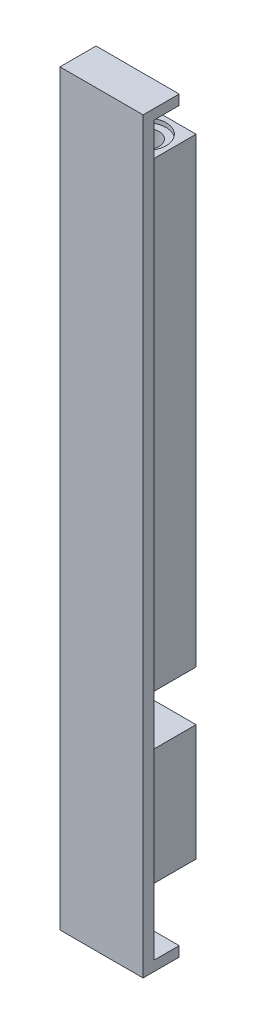
from build123d import *

# Parameters (mm, degrees)
BOSS_EXTRUDE2_DEPTH             = 75.5
BOSS_EXTRUDE3_DEPTH             = 85.5
SKETCH7_W                       = 37.5
SKETCH7_H                       = 6
SKETCH9_R                       = 1.55
CUT_EXTRUDE4_DEPTH              = 4.3
SKETCH10_R                      = 2.4
CUT_EXTRUDE5_DEPTH              = 0.5
SKETCH13_R                      = 2.4
CUT_EXTRUDE6_DEPTH              = 0.5
SKETCH14_R                      = 1.55
CUT_EXTRUDE7_DEPTH              = 4.3
SKIZZE1_W                       = 10
SKIZZE1_H                       = 1.341711746
AUFSATZ_LINEAR_AUSTRAGEN1_DEPTH = 2.2
SKIZZE2_W                       = 10
SKIZZE2_H                       = 1.2
AUFSATZ_LINEAR_AUSTRAGEN2_DEPTH = 3
SKIZZE3_W                       = 10
SKIZZE3_H                       = 1.341711746
AUFSATZ_LINEAR_AUSTRAGEN3_DEPTH = 2.2
SKIZZE4_W                       = 10
SKIZZE4_H                       = 1.2
AUFSATZ_LINEAR_AUSTRAGEN4_DEPTH = 3


with BuildPart() as part:
    # Sketch3 → Boss-Extrude2 (new body)
    with BuildSketch(Plane.XZ.offset(5)):
        with BuildLine():
            Line((-3, 37.379807383), (-3, 31.379807383))
            Line((-3, 31.379807383), (3, 31.379807383))
            Line((3, 31.379807383), (3, 37.379807383))
            ThreePointArc((3, 37.379807383), (0, 37.5), (-3, 37.379807383))
        make_face()
    extrude(amount=BOSS_EXTRUDE2_DEPTH)

    # Sketch5 → Boss-Extrude3 (add)
    with BuildSketch(Plane(origin=(0, 0, 0), x_dir=(1, 0, 0), z_dir=(0, 1, 0))):
        with BuildLine():
            Line((-5, -38.409398717), (-5, -39.236412732))
            Line((-5, -39.236412732), (-5, -39.751110463))
            Line((-5, -39.751110463), (0, -39.751110463))
            Line((0, -39.751110463), (5, -39.751110463))
            Line((5, -39.751110463), (5, -39.41427469))
            Line((5, -39.41427469), (5, -38.409398717))
            ThreePointArc((5, -38.409398717), (3.502649729, -38.574776145), (2.00000116, -38.681803282))
            Line((2.00000116, -38.681803282), (2.00000116, -37.431803282))
            ThreePointArc((2.00000116, -37.431803282), (0, -37.485195766), (-2.00000116, -37.431803282))
            Line((-2.00000116, -37.431803282), (-2.00000116, -38.681803282))
            ThreePointArc((-2.00000116, -38.681803282), (-3.502649729, -38.574776145), (-5, -38.409398717))
        make_face()
    extrude(amount=-BOSS_EXTRUDE3_DEPTH)

    # Sketch7 → Cut-Revolve1 (revolve, cut)
    with BuildSketch(Plane(origin=(0, 0, 0), x_dir=(0, 0, -1), z_dir=(1, 0, 0))):
        with Locations((-18.75, -63.5)):
            Rectangle(SKETCH7_W, SKETCH7_H)
    revolve(axis=Axis((0, -27.016689378, 0), (0, -1, 0)), mode=Mode.SUBTRACT)

    # Sketch9 → Cut-Extrude4 (cut)
    with BuildSketch(Plane(origin=(0, -80.5, 0), x_dir=(-1, 0, 0), z_dir=(0, -1, 0))):
        with Locations((0, -34.420864201)):
            Circle(SKETCH9_R)
    extrude(amount=-CUT_EXTRUDE4_DEPTH, mode=Mode.SUBTRACT)

    # Sketch10 → Cut-Extrude5 (cut)
    with BuildSketch(Plane(origin=(0, -80.5, 0), x_dir=(-1, 0, 0), z_dir=(0, -1, 0))):
        with Locations((0, -34.420864201)):
            Circle(SKETCH10_R)
    extrude(amount=-CUT_EXTRUDE5_DEPTH, mode=Mode.SUBTRACT)

    # Sketch13 → Cut-Extrude6 (cut)
    with BuildSketch(Plane(origin=(0, -5, 0), x_dir=(-1, 0, 0), z_dir=(0, -1, 0))):
        with Locations((0, -34.379807383)):
            Circle(SKETCH13_R)
    extrude(amount=CUT_EXTRUDE6_DEPTH, mode=Mode.SUBTRACT)

    # Sketch14 → Cut-Extrude7 (cut)
    with BuildSketch(Plane(origin=(0, -5, 0), x_dir=(-1, 0, 0), z_dir=(0, -1, 0))):
        with Locations((0, -34.379807383)):
            Circle(SKETCH14_R)
    extrude(amount=CUT_EXTRUDE7_DEPTH, mode=Mode.SUBTRACT)

    # Skizze1 → Aufsatz-Linear austragen1 (add)
    with BuildSketch(Plane(origin=(0, 0, 0), x_dir=(1, 0, 0), z_dir=(0, 1, 0))):
        with Locations((0, -39.08025459)):
            Rectangle(SKIZZE1_W, SKIZZE1_H)
    extrude(amount=AUFSATZ_LINEAR_AUSTRAGEN1_DEPTH)

    # Skizze2 → Aufsatz-Linear austragen2 (add)
    with BuildSketch(Plane(origin=(0, 0, 38.409398717), x_dir=(-1, 0, 0), z_dir=(0, 0, -1))):
        with Locations((0, 1.6)):
            Rectangle(SKIZZE2_W, SKIZZE2_H)
    extrude(amount=AUFSATZ_LINEAR_AUSTRAGEN2_DEPTH)

    # Skizze3 → Aufsatz-Linear austragen3 (add)
    with BuildSketch(Plane.XZ.offset(85.5)):
        with Locations((0, 39.08025459)):
            Rectangle(SKIZZE3_W, SKIZZE3_H)
    extrude(amount=AUFSATZ_LINEAR_AUSTRAGEN3_DEPTH)

    # Skizze4 → Aufsatz-Linear austragen4 (add)
    with BuildSketch(Plane(origin=(0, 0, 38.409398717), x_dir=(-1, 0, 0), z_dir=(0, 0, -1))):
        with Locations((0, -87.1)):
            Rectangle(SKIZZE4_W, SKIZZE4_H)
    extrude(amount=AUFSATZ_LINEAR_AUSTRAGEN4_DEPTH)


solid = part.part
